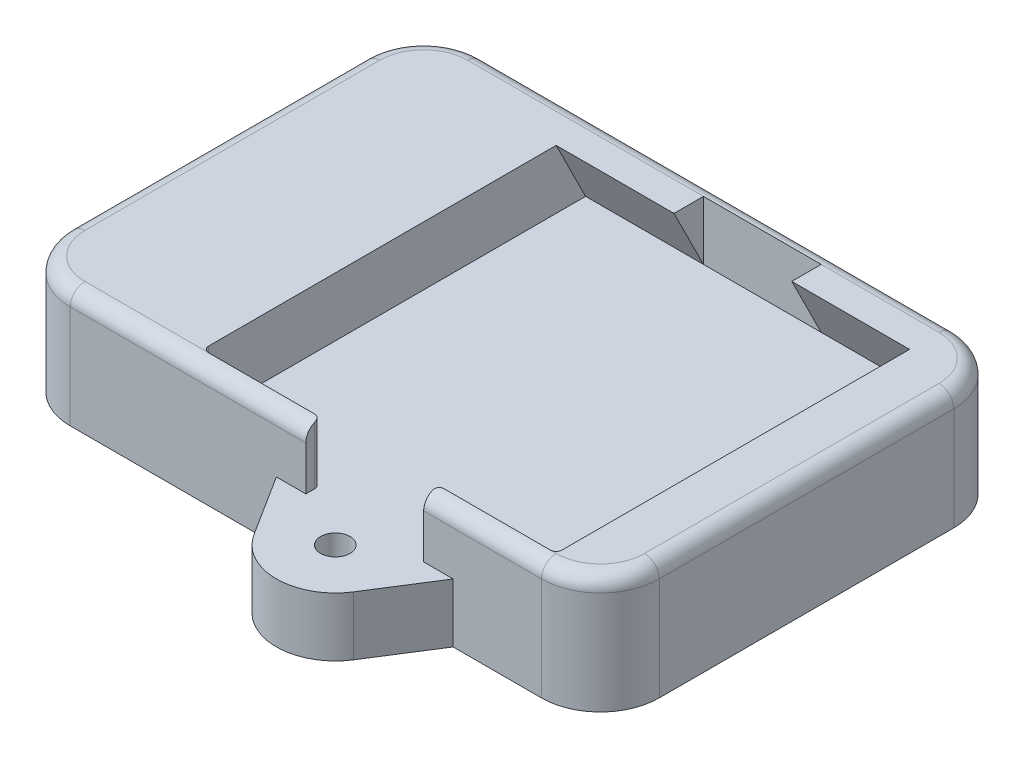
from build123d import *
from OCP.BRepFilletAPI import BRepFilletAPI_MakeChamfer

# Parameters (mm, degrees)
BOSS_EXTRUDE1_DEPTH = 20
FILLET1_R           = 2.5
SKETCH3_W           = 20
SKETCH3_H           = 5.625
SKETCH3_H_2         = 5.62
BOSS_EXTRUDE2_DEPTH = 16
FILLET2_R           = 10
SKETCH4_R           = 2.5
CUT_EXTRUDE1_DEPTH  = 74.488094444
SKETCH5_W           = 40
SKETCH5_H           = 5.62
BOSS_EXTRUDE3_DEPTH = 15
CHAMFER1_SIZE       = 35.337785487
CHAMFER1_SIZE_2     = 15
SKETCH6_R           = 2.5
CUT_EXTRUDE2_DEPTH  = 74.488094444
CUT_EXTRUDE3_DEPTH  = 10
BOSS_EXTRUDE4_DEPTH = 20
BOSS_EXTRUDE5_DEPTH = 20
BOSS_EXTRUDE6_DEPTH = 10
SKETCH12_R          = 2.5
CUT_EXTRUDE5_DEPTH  = 15


with BuildPart() as part:
    # Sketch1 → Boss-Extrude1 (new body)
    with BuildSketch(Plane(origin=(0, 0, 0), x_dir=(1, 0, 0), z_dir=(0, 1, 0))):
        with BuildLine():
            Line((40, -35), (-40, -35))
            ThreePointArc((-40, -35), (-47.071067812, -32.071067812), (-50, -25))
            Line((-50, -25), (-50, 25))
            ThreePointArc((-50, 25), (-47.071067812, 32.071067812), (-40, 35))
            Line((-40, 35), (40, 35))
            ThreePointArc((40, 35), (47.071067812, 32.071067812), (50, 25))
            Line((50, 25), (50, -25))
            ThreePointArc((50, -25), (47.071067812, -32.071067812), (40, -35))
        make_face()
    extrude(amount=BOSS_EXTRUDE1_DEPTH)

    # Fillet1
    fillet1_edges = [part.edges().sort_by_distance(p)[0] for p in [
        (-47.071067812, 20, 32.071067812),
        (0, 20, 35),
        (47.071067812, 20, 32.071067812),
        (50, 20, 0),
        (47.071067812, 20, -32.071067812),
        (0, 20, -35),
        (-47.071067812, 20, -32.071067812),
        (-50, 20, 0),
    ]]
    fillet(fillet1_edges, radius=FILLET1_R)

    # Sketch3 → Boss-Extrude2 (add)
    with BuildSketch(Plane.XZ):
        with Locations((-40, 4.0625)):
            Rectangle(SKETCH3_W, SKETCH3_H)
        with Locations((-40, 12.1925)):
            Rectangle(SKETCH3_W, SKETCH3_H)
        with Locations((-40, -12.1825)):
            Rectangle(SKETCH3_W, SKETCH3_H)
        with Locations((-40, -4.06)):
            Rectangle(SKETCH3_W, SKETCH3_H_2)
    extrude(amount=BOSS_EXTRUDE2_DEPTH)

    # Fillet2
    fillet2_edges = [part.edges().sort_by_distance(p)[0] for p in [
        (-30, -16, -12.1825),
        (-30, -16, -4.06),
        (-30, -16, 4.0625),
        (-30, -16, 12.1925),
        (-50, -16, -12.1825),
        (-50, -16, -4.06),
        (-50, -16, 4.0625),
        (-50, -16, 12.1925),
    ]]
    fillet(fillet2_edges, radius=FILLET2_R - 0.0001)  # a hair under: the kernel refuses the full size

    # Sketch4 → Cut-Extrude1 (cut, through all)
    with BuildSketch(Plane.XY.offset(15.005)):
        with Locations((-40, -8.5)):
            Circle(SKETCH4_R)
    extrude(amount=-CUT_EXTRUDE1_DEPTH, mode=Mode.SUBTRACT)

    # Sketch5 → Boss-Extrude3 (add)
    with BuildSketch(Plane.XZ):
        with Locations((-20, 4.06)):
            Rectangle(SKETCH5_W, SKETCH5_H)
        with Locations((-20, -4.06)):
            Rectangle(SKETCH5_W, SKETCH5_H)
    extrude(amount=BOSS_EXTRUDE3_DEPTH)

    # Chamfer1
    chamfer1_edges_1 = [part.edges().sort_by_distance(p)[0] for p in [
        (0, -15, -4.06),
    ]]
    chamfer1_side_1 = [part.faces().sort_by_distance(p)[0] for p in [
        (-0.3, -15, -4.06),
    ]]
    chamfer1_edges_2 = [part.edges().sort_by_distance(p)[0] for p in [
        (0, -15, 4.06),
    ]]
    chamfer1_side_2 = [part.faces().sort_by_distance(p)[0] for p in [
        (0, -14.7, 4.06),
    ]]
    chamfer1 = BRepFilletAPI_MakeChamfer(part.part.solid().wrapped)
    for e in chamfer1_edges_1:
        chamfer1.Add(CHAMFER1_SIZE - 0.0001, CHAMFER1_SIZE_2 - 0.0001, e.wrapped, chamfer1_side_1[0].wrapped)
    for e in chamfer1_edges_2:
        chamfer1.Add(CHAMFER1_SIZE_2 - 0.0001, CHAMFER1_SIZE - 0.0001, e.wrapped, chamfer1_side_2[0].wrapped)
    add(Compound.cast(chamfer1.Shape()), mode=Mode.REPLACE)  # a hair under: the kernel refuses the full size

    # Sketch6 → Cut-Extrude2 (cut, through all)
    with BuildSketch(Plane.XY.offset(15.005)):
        with Locations((-40, -8.5)):
            Circle(SKETCH6_R)
    extrude(amount=-CUT_EXTRUDE2_DEPTH, mode=Mode.SUBTRACT)

    # Sketch7 → Cut-Extrude3 (cut)
    with BuildSketch(Plane(origin=(0, 20, 0), x_dir=(1, 0, 0), z_dir=(0, 1, 0))):
        with BuildLine():
            Line((0, -33.5), (0, -42.5))
            Line((0, -42.5), (20, -42.5))
            Line((20, -42.5), (20, -33.5))
            ThreePointArc((20, -33.5), (20.292893219, -32.792893219), (21, -32.5))
            Line((21, -32.5), (39, -32.5))
            ThreePointArc((39, -32.5), (39.707106781, -32.207106781), (40, -31.5))
            Line((40, -31.5), (40, 32.5))
            Line((40, 32.5), (-20, 32.5))
            Line((-20, 32.5), (-20, -31.5))
            ThreePointArc((-20, -31.5), (-19.707106781, -32.207106781), (-19, -32.5))
            Line((-19, -32.5), (-1, -32.5))
            ThreePointArc((-1, -32.5), (-0.292893219, -32.792893219), (0, -33.5))
        make_face()
    extrude(amount=-CUT_EXTRUDE3_DEPTH, mode=Mode.SUBTRACT)

    # Sketch8 → Boss-Extrude4 (add)
    with BuildSketch(Plane(origin=(-20, 0, 0), x_dir=(0, 0, -1), z_dir=(1, 0, 0))):
        Polygon((32.5, 10), (27.5, 20), (32.5, 20), align=None)
    extrude(amount=BOSS_EXTRUDE4_DEPTH)

    # Sketch9 → Boss-Extrude5 (add)
    with BuildSketch(Plane.ZY.offset(-40)):
        Polygon((-32.5, 10), (-27.5, 20), (-32.5, 20), align=None)
    extrude(amount=BOSS_EXTRUDE5_DEPTH)

    # Sketch10 → Boss-Extrude6 (add)
    with BuildSketch(Plane.XZ):
        with BuildLine():
            Line((-5, 35), (25, 35))
            Line((25, 35), (18.449489743, 45.348469228))
            ThreePointArc((18.449489743, 45.348469228), (10, 50), (1.550510257, 45.348469228))
            Line((1.550510257, 45.348469228), (-5, 35))
        make_face()
    extrude(amount=-BOSS_EXTRUDE6_DEPTH)

    # Sketch12 → Cut-Extrude5 (cut)
    with BuildSketch(Plane(origin=(0, 10, 0), x_dir=(1, 0, 0), z_dir=(0, 1, 0))):
        with Locations(Location((10, -40, 0), (0, 0, 270))):
            Circle(SKETCH12_R)
    extrude(amount=-CUT_EXTRUDE5_DEPTH, mode=Mode.SUBTRACT)


solid = part.part
